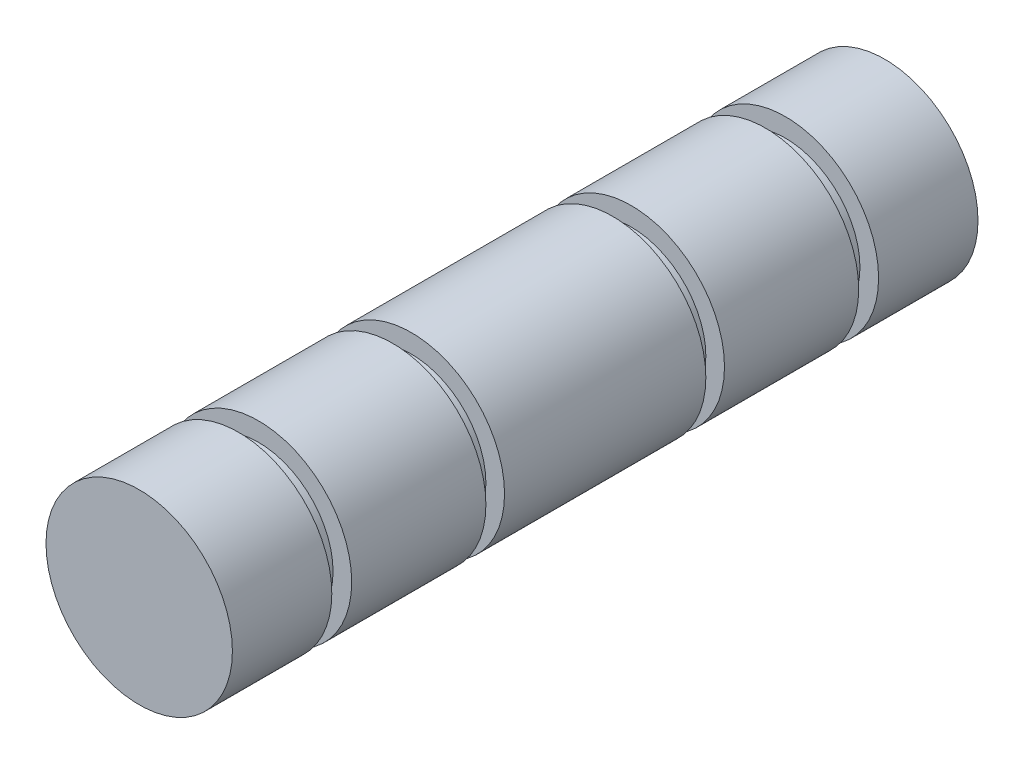
from build123d import *

# Parameters (mm, degrees)
SKETCH1_R           = 4.7625
BOSS_EXTRUDE1_DEPTH = 19.05
SKETCH2_W           = 0.9525
SKETCH2_H           = 1.016
SKETCH2_H_2         = 0.9525


with BuildPart() as part:
    # Sketch1 → Boss-Extrude1 (new, symmetric)
    with BuildSketch(Plane.XY):
        Circle(SKETCH1_R)
    extrude(amount=BOSS_EXTRUDE1_DEPTH, both=True)

    # Sketch2 → Cut-Revolve1 (revolve, cut)
    with BuildSketch(Plane(origin=(0, 0, 0), x_dir=(1, 0, 0), z_dir=(0, 1, 0))):
        with Locations((4.28625, 13.462)):
            Rectangle(SKETCH2_W, SKETCH2_H)
        with Locations((4.28625, -13.462)):
            Rectangle(SKETCH2_W, SKETCH2_H)
        with Locations((4.28625, 5.61975)):
            Rectangle(SKETCH2_W, SKETCH2_H_2)
        with Locations((4.28625, -5.61975)):
            Rectangle(SKETCH2_W, SKETCH2_H_2)
    revolve(axis=Axis((0, 0, 19.05), (0, 0, -1)), mode=Mode.SUBTRACT)


solid = part.part
